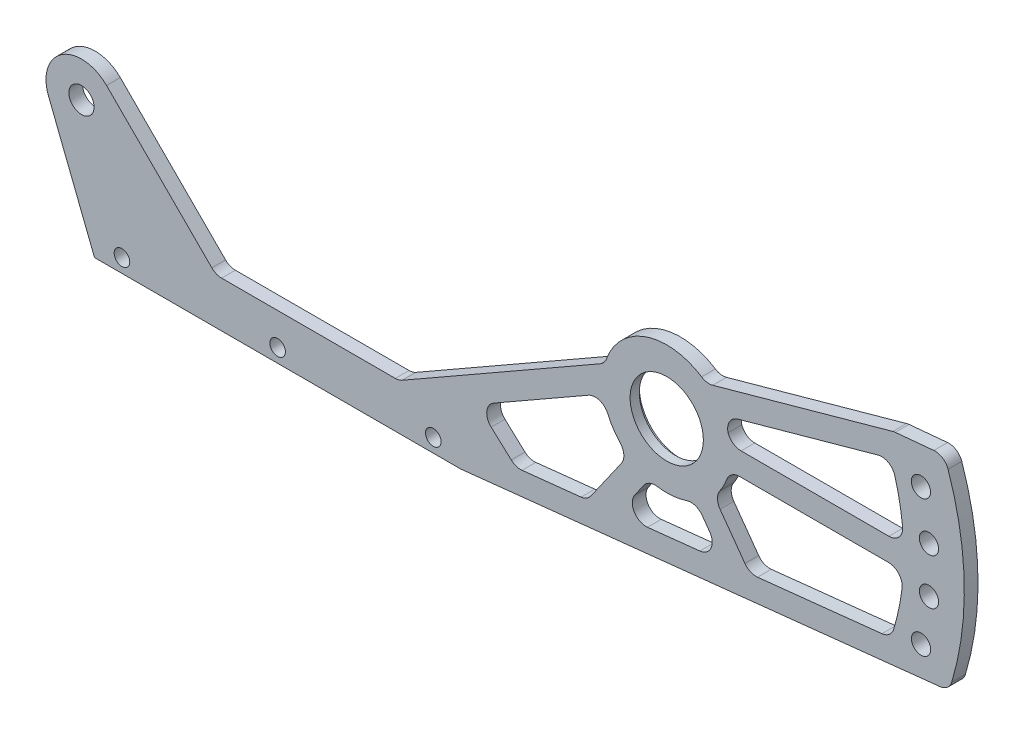
from build123d import *

# Parameters (mm, degrees)
SKETCH_1_R          = 8.000000000000027
EXTRUDE_1_DEPTH     = 3
HOLE_WIZARD_M31_D   = 3.4
SKETCH_5_R          = 2.749999999999999
EXTRUDE_2_DEPTH     = 3
CUT_EXTRUDE_1_DEPTH = 198.9348007797117
M5X0_81_D           = 4.2
CUT_EXTRUDE_2_DEPTH = 198.9348007797117
CUT_EXTRUDE_3_DEPTH = 198.9348007797117
FILLET_1_R          = 3
SKETCH_12_R         = 8.999999999999996
CUT_EXTRUDE_4_DEPTH = 1


with BuildPart() as part:
    # Эскиз1 → Бобышка-Вытянуть1 (new body)
    with BuildSketch(Plane.XY):
        with BuildLine():
            Line((0, 0), (80, 0))
            Line((80, 0), (186.64735263363326, 11.394080625595256))
            ThreePointArc((186.64735263363326, 11.394080625595256), (189.98303763522418, 33.48486352875775), (185.64181138843185, 55.40022887772366))
            Line((185.64181138843185, 55.40022887772366), (29.81788185582472, 40.959090919498855))
            Line((29.81788185582472, 40.959090919498855), (1.6e-16, 40.959090919498855))
            Line((1.6e-16, 40.959090919498855), (0, 0))
        make_face()
        with Locations((124.99999999999999, 31.999999999999986)):
            Circle(SKETCH_1_R, mode=Mode.SUBTRACT)
    extrude(amount=EXTRUDE_1_DEPTH)

    # Отверстие с зазором M31 (through all)
    with Locations(Plane.XY.offset(3)):
        with Locations((6, 3), (40, 3), (74, 3)):
            Hole(HOLE_WIZARD_M31_D / 2)

    # Эскиз5 → Бобышка-Вытянуть2 (add)
    with BuildSketch(Plane.XY.offset(3)):
        with BuildLine():
            Line((-10.05858051013897, 25.55645888767347), (0, 0))
            Line((0, 0), (0, 21.18668565496398))
            ThreePointArc((0, 21.18668565496398), (0.24099496955508215, 35.503000018294074), (-10.05858051013897, 25.55645888767347))
        make_face()
        with Locations((-2.8470386460772503, 28.39479712384004)):
            Circle(SKETCH_5_R, mode=Mode.SUBTRACT)
    extrude(amount=-EXTRUDE_2_DEPTH)

    # Эскиз6 → Вырез-Вытянуть1 (cut, through all)
    with BuildSketch(Plane.XY.offset(3)):
        with BuildLine():
            Line((2.6330389081184924, 33.874874678035766), (26.507913586154185, 10.000000000000002))
            Line((26.507913586154185, 10.000000000000002), (66.50791358615419, 10))
            Line((66.50791358615419, 10), (104.37682925914895, 47.8689156729949))
            Line((104.37682925914895, 47.8689156729949), (29.817881855824798, 40.95909091949886))
            Line((29.817881855824798, 40.95909091949886), (1.6e-16, 40.959090919498855))
            Line((1.6e-16, 40.959090919498855), (0, 35.60290859271609))
            ThreePointArc((0, 35.60290859271609), (1.4052244403019993, 34.874053149358424), (2.6330389081184924, 33.874874678035766))
        make_face()
    extrude(amount=-CUT_EXTRUDE_1_DEPTH, mode=Mode.SUBTRACT)

    # Отверстие обработанное метчиком M5x0.81 (through all)
    with Locations(Plane.XY.offset(3)):
        with Locations((180.527942872, 46.929754199), (182.276873258, 37.060611597), (182.285474835, 27.037704871), (180.553486246, 17.165574973)):
            Hole(M5X0_81_D / 2)

    # Эскиз10 → Вырез-Вытянуть2 (cut, through all)
    with BuildSketch(Plane.XY.offset(3)):
        with BuildLine():
            Line((66.50791358615419, 10), (111.50918528954904, 35.741379217384946))
            ThreePointArc((111.50918528954904, 35.741379217384946), (120.64604118056285, 45.30575223723353), (133.66945767503876, 42.9927477739058))
            Line((133.66945767503876, 42.9927477739058), (174.65262323365093, 54.38179491403086))
            Line((174.65262323365093, 54.38179491403086), (104.37682925914895, 47.8689156729949))
            Line((104.37682925914895, 47.8689156729949), (66.50791358615419, 10))
        make_face()
    extrude(amount=-CUT_EXTRUDE_2_DEPTH, mode=Mode.SUBTRACT)

    # Эскиз11 → Вырез-Вытянуть3 (cut, through all)
    with BuildSketch(Plane.XY.offset(3)):
        with BuildLine():
            Line((92.03441017428995, 6.314197935775633), (107.63021765734568, 7.980436088856215))
            Line((107.63021765734568, 7.980436088856215), (116.60825973560767, 20.79380995453953))
            ThreePointArc((116.60825973560767, 20.79380995453953), (113.01565006615179, 24.762917945534056), (111.17548635848748, 29.790289028937345))
            Line((111.17548635848748, 29.790289028937345), (83.6237542782258, 14.03029921690936))
            Line((83.6237542782258, 14.03029921690936), (92.03441017428995, 6.314197935775633))
        make_face()
        with BuildLine():
            Line((173.93078584223207, 48.99172434981097), (137.24012127463044, 38.79554495109394))
            ThreePointArc((137.24012127463044, 38.79554495109394), (138.25871477406997, 36.49516212609262), (138.84915367150305, 34.04962010701802))
            Line((138.84915367150305, 34.04962010701802), (176.75654119949715, 34.04962010701802))
            ThreePointArc((176.75654119949715, 34.04962010701802), (175.8950005059697, 41.62493755905363), (173.93078584223207, 48.99172434981097))
        make_face()
        with BuildLine():
            Line((121.13678636305278, 18.543567322826398), (114.22945460790407, 8.685490982627265))
            Line((114.22945460790407, 8.685490982627265), (137.37877384972535, 11.158737653597806))
            Line((137.37877384972535, 11.158737653597806), (131.35012272889716, 19.52298347648991))
            ThreePointArc((131.35012272889716, 19.52298347648991), (126.33641056880738, 18.063931444213534), (121.13678636305278, 18.543567322826398))
        make_face()
        with BuildLine():
            Line((143.10149490164468, 11.770146595809063), (173.95081110549165, 15.066052095485405))
            ThreePointArc((173.95081110549165, 15.066052095485405), (175.8152185482702, 21.96236763923512), (176.7130134299426, 29.049620107018022))
            Line((176.7130134299426, 29.049620107018022), (138.68558579261725, 29.049620107018022))
            ThreePointArc((138.68558579261725, 29.049620107018022), (137.43996226457978, 25.57759088380138), (135.33074101249935, 22.551413326181333))
            Line((135.33074101249935, 22.551413326181333), (143.10149490164468, 11.770146595809063))
        make_face()
    extrude(amount=-CUT_EXTRUDE_3_DEPTH, mode=Mode.SUBTRACT)

    # Скругление1
    # the kernel refuses this fillet: 3 mm, written as the material it adds along each edge
    with BuildSketch(Plane(origin=(133.66945767503876, 42.992747773905805, 3), x_dir=(-0.8130725400087585, 0.5821623868678788, 0), z_dir=(0, 0, -1))) as fillet_1_piece_1:
        with BuildLine():
            CenterArc((1.4378103136794376, 2.996771470104822), FILLET_1_R, 218.86683700391524, 48.47477501487009)
            Line((-0.8980091423480934, 1.1142339621535844), (0, 0))
            ThreePointArc((0, 0), (0.6493336900487631, 0.01506647284415901), (1.2986673800975244, 0))
        make_face()
    extrude(amount=3)
    with BuildSketch(Plane(origin=(111.50918528954904, 35.741379217384946, 3), x_dir=(-0.8680239741683529, -0.49652228577273216, 0), z_dir=(0, 0, -1))) as fillet_1_piece_2:
        with BuildLine():
            CenterArc((1.16542958022559, 2.9999999999999964), FILLET_1_R, 229.5997180782211, 40.4002819217792)
            ThreePointArc((-0.7789413643040896, 0.7153946445679564), (-0.382712836911811, 0.3650554500406897), (0, 0))
            Line((0, 0), (1.165429580225606, 1e-17))
        make_face()
    extrude(amount=3)
    with BuildSketch(Plane(origin=(92.03441017428995, 6.314197935775633, 3), x_dir=(0.9943411291859616, 0.10623426381910231, 0), z_dir=(0, 0, -1))) as fillet_1_piece_3:
        with BuildLine():
            CenterArc((FILLET_1_R * 0.451855277113, -FILLET_1_R), FILLET_1_R, 89.9999999999999, 48.632165419305906)
            Line((-FILLET_1_R * 0.298626929798, -FILLET_1_R * 0.339109345572), (0, 0))
            Line((0, 0), (FILLET_1_R * 0.451855277113, -1e-17))
        make_face()
    extrude(amount=3)
    with BuildSketch(Plane(origin=(83.6237542782258, 14.03029921690936, 3), x_dir=(0.8680239741683552, 0.496522285772728, 0), z_dir=(0, 0, -1))) as fillet_1_piece_4:
        with BuildLine():
            CenterArc((FILLET_1_R * 1.36872958736, FILLET_1_R), FILLET_1_R, 162.30406475526607, 107.69593524473399)
            Line((FILLET_1_R * 0.416046539376, FILLET_1_R * 1.30396547515), (0, 0))
            Line((0, 0), (FILLET_1_R * 1.36872958736, -5e-17))
        make_face()
    extrude(amount=3)
    with BuildSketch(Plane(origin=(111.17548635848748, 29.790289028937345, 3), x_dir=(0.2779694371109165, -0.960589918764631, 0), z_dir=(0, 0, -1))) as fillet_1_piece_5:
        with BuildLine():
            CenterArc((3.8089394275276667, 2.977268689428244), FILLET_1_R, 166.36886991345514, 96.57341947464624)
            Line((0.893440130163459, 3.684279189398942), (0, 0))
            ThreePointArc((0, 0), (1.720166193077011, 0.10607944933485743), (3.4403323861540267, -8e-17))
        make_face()
    extrude(amount=3)
    with BuildSketch(Plane(origin=(116.60825973560767, 20.79380995453953, 3), x_dir=(-0.5738346401441979, -0.8189711873873091, 0), z_dir=(0, 0, -1))) as fillet_1_piece_6:
        with BuildLine():
            CenterArc((2.6548645047083914, 3.0000000000000018), FILLET_1_R, 191.68179125859942, 78.31820874140055)
            ThreePointArc((-0.28299711772598396, 2.392571742979232), (-0.08993594197380265, 1.2023847782433434), (0, 0))
            Line((0, 0), (2.654864504708389, 0))
        make_face()
    extrude(amount=3)
    with BuildSketch(Plane(origin=(107.63021765734568, 7.980436088856215, 3), x_dir=(-0.9943411291859616, -0.10623426381910264, 0), z_dir=(0, 0, -1))) as fillet_1_piece_7:
        with BuildLine():
            CenterArc((FILLET_1_R * 0.4545006609, FILLET_1_R), FILLET_1_R, 221.11634455075327, 48.883655449246646)
            Line((-FILLET_1_R * 0.298875173788, FILLET_1_R * 0.342409814772), (0, 0))
            Line((0, 0), (FILLET_1_R * 0.4545006609, 0))
        make_face()
    extrude(amount=3)
    with BuildSketch(Plane(origin=(137.37877384972535, 11.158737653597806, 3), x_dir=(-0.9943411291859617, -0.10623426381910242, 0), z_dir=(0, 0, -1))) as fillet_1_piece_8:
        with BuildLine():
            CenterArc((FILLET_1_R * 1.72108797237, FILLET_1_R), FILLET_1_R, 150.3155592750541, 119.68444072494606)
            Line((FILLET_1_R * 0.852321942917, FILLET_1_R * 1.49522276409), (0, 0))
            Line((0, 0), (FILLET_1_R * 1.72108797237, -6e-17))
        make_face()
    extrude(amount=3)
    with BuildSketch(Plane(origin=(114.22945460790407, 8.685490982627265, 3), x_dir=(0.5738346401441975, 0.8189711873873095, 0), z_dir=(0, 0, -1))) as fillet_1_piece_9:
        with BuildLine():
            CenterArc((FILLET_1_R * 2.20021682261, FILLET_1_R), FILLET_1_R, 138.8836554492469, 131.11634455075307)
            Line((FILLET_1_R * 1.44684098792, FILLET_1_R * 1.65759018523), (0, 0))
            Line((0, 0), (FILLET_1_R * 2.20021682261, 2e-17))
        make_face()
    extrude(amount=3)
    with BuildSketch(Plane(origin=(121.13678636305278, 18.543567322826398, 3), x_dir=(-0.5738346401441984, -0.8189711873873087, 0), z_dir=(0, 0, -1))) as fillet_1_piece_10:
        with BuildLine():
            CenterArc((1.990265982493936, -3.0000000000000013), FILLET_1_R, 89.99999999999993, 63.60335445318877)
            ThreePointArc((-0.6969473887897009, -1.666251786432529), (-0.32157533753284756, -0.844376737614642), (0, 0))
            Line((0, 0), (1.9902659824939402, 5e-17))
        make_face()
    extrude(amount=3)
    with BuildSketch(Plane(origin=(131.35012272889716, 19.522983476489905, 3), x_dir=(0.5847130820131278, -0.8112401689528875, 0), z_dir=(0, 0, -1))) as fillet_1_piece_11:
        with BuildLine():
            CenterArc((2.3682065417982856, 3.0000000000000004), FILLET_1_R, 197.6131255819165, 72.3868744180835)
            ThreePointArc((-0.4911575816723561, 2.0922352675891354), (-0.20537262369653822, 1.0555561343908344), (0, 0))
            Line((0, 0), (2.368206541798286, 1e-17))
        make_face()
    extrude(amount=3)
    with BuildSketch(Plane(origin=(173.93078584223207, 48.99172434981097, 3), x_dir=(-0.9634885943550286, -0.26774937637232876, 0), z_dir=(0, 0, -1))) as fillet_1_piece_12:
        with BuildLine():
            CenterArc((2.897416461846995, -3.0000000000000013), FILLET_1_R, 90.00000000000013, 89.6828037551533)
            ThreePointArc((-0.1025375653525866, -2.9833917282944458), (-0.07276547265506263, -1.4909570345015974), (0, 0))
            Line((0, 0), (2.8974164618469884, -5e-17))
        make_face()
    extrude(amount=3)
    with BuildSketch(Plane(origin=(176.75654119949715, 34.04962010701802, 3), x_dir=(-1, 0, 0), z_dir=(0, 0, -1))) as fillet_1_piece_13:
        with BuildLine():
            CenterArc((3.221407714928148, 3), FILLET_1_R, 174.06028761643057, 95.93971238356943)
            ThreePointArc((0.23751372052348074, 3.310445857043881), (0.09223500645424565, 1.6571257852503223), (0, 0))
            Line((0, 0), (3.221407714928148, 0))
        make_face()
    extrude(amount=3)
    with BuildSketch(Plane(origin=(138.84915367150305, 34.04962010701802, 3), x_dir=(-0.22238352713061194, 0.9749592642059198, 0), z_dir=(0, 0, -1))) as fillet_1_piece_14:
        with BuildLine():
            CenterArc((2.394810958848804, 2.9910348047399777), FILLET_1_R, 192.84906769128517, 72.72030630224907)
            Line((-0.5300668337689619, 2.32388422334817), (0, 0))
            ThreePointArc((0, 0), (1.081527529802683, 0.04183757788016305), (2.163055059605388, 0))
        make_face()
    extrude(amount=3)
    with BuildSketch(Plane(origin=(137.24012127463044, 38.79554495109394, 3), x_dir=(0.9634885943550292, 0.2677493763723269, 0), z_dir=(0, 0, -1))) as fillet_1_piece_15:
        with BuildLine():
            CenterArc((3.3851332754644625, 3.0000000000000013), FILLET_1_R, 179.08948046092507, 90.91051953907493)
            ThreePointArc((0.3855120801952658, 3.047672684965048), (0.27660128884680796, 1.5132304278712665), (0, 0))
            Line((0, 0), (3.3851332754644634, 6e-17))
        make_face()
    extrude(amount=3)
    with BuildSketch(Plane(origin=(143.10149490164468, 11.770146595809063, 3), x_dir=(0.9943411291859617, 0.10623426381910227, 0), z_dir=(0, 0, -1))) as fillet_1_piece_16:
        with BuildLine():
            CenterArc((FILLET_1_R * 0.581027824292, -FILLET_1_R), FILLET_1_R, 90.00000000000017, 60.3155592750542)
            Line((-FILLET_1_R * 0.287738205159, -FILLET_1_R * 0.50477723591), (0, 0))
            Line((0, 0), (FILLET_1_R * 0.581027824292, -1e-17))
        make_face()
    extrude(amount=3)
    with BuildSketch(Plane(origin=(135.33074101249935, 22.551413326181333, 3), x_dir=(0.6191906205716086, 0.7852407117541386, 0), z_dir=(0, 0, -1))) as fillet_1_piece_17:
        with BuildLine():
            CenterArc((2.264587612579221, 2.9919845725048013), FILLET_1_R, 195.96022348085205, 69.85051867741447)
            Line((-0.6197708484362799, 2.1670747178126035), (0, 0))
            ThreePointArc((0, 0), (1.0227169863260859, 0.03740532831092148), (2.0454339726521837, 5e-17))
        make_face()
    extrude(amount=3)
    with BuildSketch(Plane(origin=(138.68558579261725, 29.049620107018022, 3), x_dir=(1, 0, 0), z_dir=(0, 0, -1))) as fillet_1_piece_18:
        with BuildLine():
            CenterArc((2.239017157823781, 3), FILLET_1_R, 200.4886819411101, 69.51131805888991)
            ThreePointArc((-0.5712068922540539, 1.9499329600620143), (-0.2501815737843174, 0.9853428458000373), (0, 0))
            Line((0, 0), (2.239017157823781, 0))
        make_face()
    extrude(amount=3)
    with BuildSketch(Plane(origin=(176.7130134299426, 29.049620107018022, 3), x_dir=(-0.08949841173945887, -0.9959869649227917, 0), z_dir=(0, 0, -1))) as fillet_1_piece_19:
        with BuildLine():
            CenterArc((3.2815211967518683, 2.998403344451645), FILLET_1_R, 174.86524824854192, 97.00415022459947)
            Line((0.29356030198349303, 3.266898579670022), (0, 0))
            ThreePointArc((0, 0), (1.6896926532610193, -0.02756738048459419), (3.37938530652206, -2e-17))
        make_face()
    extrude(amount=3)
    with BuildSketch(Plane(origin=(173.95081110549165, 15.066052095485404, 3), x_dir=(-0.994341129185962, -0.1062342638191007, 0), z_dir=(0, 0, -1))) as fillet_1_piece_20:
        with BuildLine():
            CenterArc((1.944914405279492, 2.9999999999999996), FILLET_1_R, 202.9640654934915, 67.03593450650857)
            ThreePointArc((-0.8173347828283964, 1.8295387991063596), (-0.41751534735678364, 0.9108166317013427), (0, 0))
            Line((0, 0), (1.944914405279496, -1e-17))
        make_face()
    extrude(amount=3)
    with BuildSketch(Plane(origin=(66.50791358615419, 10, 3), x_dir=(-1, 0, 0), z_dir=(0, 0, -1))) as fillet_1_piece_21:
        with BuildLine():
            CenterArc((FILLET_1_R * 0.265800810182, FILLET_1_R), FILLET_1_R, 240.229818231195, 29.770181768805003)
            Line((-FILLET_1_R * 0.230721475591, FILLET_1_R * 0.131976025832), (0, 0))
            Line((0, 0), (FILLET_1_R * 0.265800810182, 0))
        make_face()
    extrude(amount=3)
    with BuildSketch(Plane(origin=(26.507913586154185, 10.000000000000002, 3), x_dir=(-0.7071067811865482, 0.7071067811865468, 0), z_dir=(0, 0, -1))) as fillet_1_piece_22:
        with BuildLine():
            CenterArc((FILLET_1_R * 0.414213562373, FILLET_1_R), FILLET_1_R, 225.00000000000006, 45.000000000000114)
            Line((-FILLET_1_R * 0.292893218813, FILLET_1_R * 0.292893218813), (0, 0))
            Line((0, 0), (FILLET_1_R * 0.414213562373, 1e-17))
        make_face()
    extrude(amount=3)
    # the kernel refuses this fillet: 3 mm, written as the material it takes off along each edge
    with BuildSketch(Plane(origin=(185.64181138843185, 55.40022887772366, -5.916554139644239), x_dir=(0.3429596926027861, -0.9393501206950486, 0), z_dir=(0, 0, 1))) as fillet_1_2_piece_1:
        with BuildLine():
            CenterArc((2.312007309953282, -2.999502837675169), FILLET_1_R, 88.95688520370253, 76.28063656309585)
            Line((-0.5889640915743037, -2.2350651832395365), (0, 0))
            ThreePointArc((0, 0), (1.183310827928844, 0.010771850371206), (2.366621655857689, 6e-17))
        make_face()
    extrude(amount=14.833108279288478, mode=Mode.SUBTRACT)
    with BuildSketch(Plane(origin=(174.6526232336509, 54.381794914030856, 3.6717035747929345), x_dir=(-0.9634885943550205, -0.26774937637235796, 0), z_dir=(0, 0, -1))) as fillet_1_2_piece_2:
        with BuildLine():
            CenterArc((FILLET_1_R * 0.0895604766391, -FILLET_1_R), FILLET_1_R, 90.00000000000188, 10.235566175230105)
            Line((-FILLET_1_R * 0.0881351658569, -FILLET_1_R * 0.0159145064386), (0, 0))
            Line((0, 0), (FILLET_1_R * 0.0895604766391, -1e-17))
        make_face()
    extrude(amount=4.34340714958587, mode=Mode.SUBTRACT)
    with BuildSketch(Plane(origin=(186.64735263363326, 11.394080625595256, -5.014960799028406), x_dir=(-0.9943411291859617, -0.10623426381910225, 0), z_dir=(0, 0, 1))) as fillet_1_2_piece_3:
        with BuildLine():
            CenterArc((1.9591455422097777, -2.9999999999999996), FILLET_1_R, 89.99999999999983, 67.1875610802881)
            ThreePointArc((-0.806191458360402, -1.8368528582859858), (-0.41018210878156197, -0.9153162297170893), (0, 0))
            Line((0, 0), (1.9591455422097865, 2e-17))
        make_face()
    extrude(amount=13.029921598056813, mode=Mode.SUBTRACT)

    # Эскиз12 → Вырез-Вытянуть4 (cut)
    with BuildSketch(Plane.XY):
        with Locations((124.99999999999999, 31.999999999999986)):
            Circle(SKETCH_12_R)
    extrude(amount=CUT_EXTRUDE_4_DEPTH, mode=Mode.SUBTRACT)


solid = part.part
